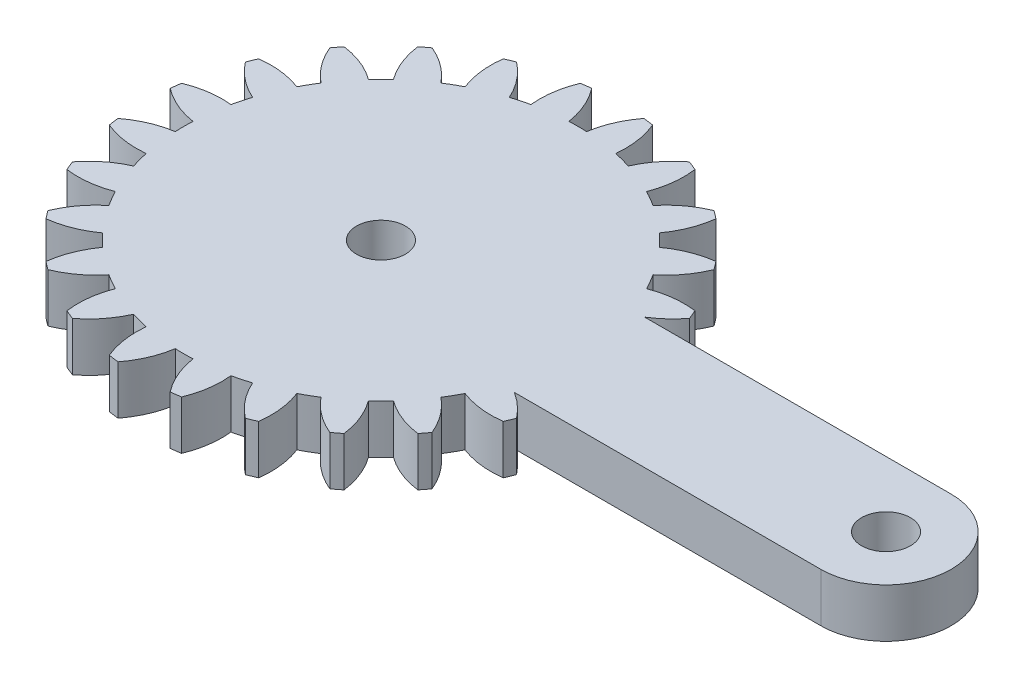
from build123d import *

# Parameters (mm, degrees)
SKETCH1_R           = 1.5
BOSS_EXTRUDE1_DEPTH = 3


with BuildPart() as part:
    # Sketch1 → Boss-Extrude1 (new body)
    with BuildSketch(Plane(origin=(0, 0, 0), x_dir=(1, 0, 0), z_dir=(0, 1, 0))):
        with BuildLine():
            Line((20.893657446, 4), (2.081641936, 4))
            ThreePointArc((2.081641936, 4), (2.861028333, 4.588201733), (3.521749436, 5.30713988))
            ThreePointArc((3.521749436, 5.30713988), (3.405395609, 5.596745198), (3.282888305, 5.883801663))
            ThreePointArc((3.282888305, 5.883801663), (1.93527598, 5.894040025), (0.627094961, 5.57027124))
            ThreePointArc((0.627094961, 5.57027124), (0.366286148, 6.046375), (0.084372603, 6.510293938))
            ThreePointArc((0.084372603, 6.510293938), (1.018855105, 7.48132754), (1.683794586, 8.65351323))
            ThreePointArc((1.683794586, 8.65351323), (1.496450048, 8.903135899), (1.303821399, 9.148703928))
            ThreePointArc((1.303821399, 9.148703928), (-0.000522033, 8.809805691), (-1.180330337, 8.158486898))
            ThreePointArc((-1.180330337, 8.158486898), (-1.555477026, 8.550865528), (-1.947855656, 8.926012217))
            ThreePointArc((-1.947855656, 8.926012217), (-1.296536862, 10.105820521), (-0.957638625, 11.410163953))
            ThreePointArc((-0.957638625, 11.410163953), (-1.203206655, 11.602792602), (-1.452829324, 11.79013714))
            ThreePointArc((-1.452829324, 11.79013714), (-2.625015014, 11.125197659), (-3.596048616, 10.190715157))
            ThreePointArc((-3.596048616, 10.190715157), (-4.059967554, 10.472628702), (-4.536071314, 10.733437515))
            ThreePointArc((-4.536071314, 10.733437515), (-4.212302529, 12.041618533), (-4.222540891, 13.389230859))
            ThreePointArc((-4.222540891, 13.389230859), (-4.509597355, 13.511738163), (-4.799202674, 13.62809199))
            ThreePointArc((-4.799202674, 13.62809199), (-5.759348103, 12.682425791), (-6.455432668, 11.528463019))
            ThreePointArc((-6.455432668, 11.528463019), (-6.976508546, 11.680699536), (-7.503891752, 11.809396783))
            ThreePointArc((-7.503891752, 11.809396783), (-7.529737283, 13.156800143), (-7.888414517, 14.455843809))
            ThreePointArc((-7.888414517, 14.455843809), (-8.197396993, 14.499881098), (-8.507248835, 14.537314892))
            ThreePointArc((-8.507248835, 14.537314892), (-9.18992168, 13.375367565), (-9.563620196, 12.080565177))
            ThreePointArc((-9.563620196, 12.080565177), (-10.106342554, 12.09275), (-10.649064912, 12.080565177))
            ThreePointArc((-10.649064912, 12.080565177), (-11.022763428, 13.375367565), (-11.705436272, 14.537314892))
            ThreePointArc((-11.705436272, 14.537314892), (-12.015288115, 14.499881098), (-12.324270591, 14.455843809))
            ThreePointArc((-12.324270591, 14.455843809), (-12.682947825, 13.156800143), (-12.708793355, 11.809396783))
            ThreePointArc((-12.708793355, 11.809396783), (-13.236176561, 11.680699536), (-13.757252439, 11.528463019))
            ThreePointArc((-13.757252439, 11.528463019), (-14.453337005, 12.682425791), (-15.413482434, 13.62809199))
            ThreePointArc((-15.413482434, 13.62809199), (-15.703087752, 13.511738163), (-15.990144217, 13.389230859))
            ThreePointArc((-15.990144217, 13.389230859), (-16.000382579, 12.041618533), (-15.676613793, 10.733437515))
            ThreePointArc((-15.676613793, 10.733437515), (-16.152717554, 10.472628702), (-16.616636492, 10.190715157))
            ThreePointArc((-16.616636492, 10.190715157), (-17.587670094, 11.125197659), (-18.759855783, 11.79013714))
            ThreePointArc((-18.759855783, 11.79013714), (-19.009478453, 11.602792602), (-19.255046482, 11.410163953))
            ThreePointArc((-19.255046482, 11.410163953), (-18.916148245, 10.105820521), (-18.264829452, 8.926012217))
            ThreePointArc((-18.264829452, 8.926012217), (-18.657208082, 8.550865528), (-19.032354771, 8.158486898))
            ThreePointArc((-19.032354771, 8.158486898), (-20.212163074, 8.809805691), (-21.516506507, 9.148703928))
            ThreePointArc((-21.516506507, 9.148703928), (-21.709135156, 8.903135899), (-21.896479694, 8.65351323))
            ThreePointArc((-21.896479694, 8.65351323), (-21.231540213, 7.48132754), (-20.297057711, 6.510293938))
            ThreePointArc((-20.297057711, 6.510293938), (-20.578971255, 6.046375), (-20.839780068, 5.57027124))
            ThreePointArc((-20.839780068, 5.57027124), (-22.147961087, 5.894040025), (-23.495573413, 5.883801663))
            ThreePointArc((-23.495573413, 5.883801663), (-23.618080717, 5.596745198), (-23.734434544, 5.30713988))
            ThreePointArc((-23.734434544, 5.30713988), (-22.788768345, 4.346994451), (-21.634805572, 3.650909885))
            ThreePointArc((-21.634805572, 3.650909885), (-21.78704209, 3.129834008), (-21.915739337, 2.602450802))
            ThreePointArc((-21.915739337, 2.602450802), (-23.263142697, 2.576605271), (-24.562186363, 2.217928037))
            ThreePointArc((-24.562186363, 2.217928037), (-24.606223651, 1.908945561), (-24.643657446, 1.599093719))
            ThreePointArc((-24.643657446, 1.599093719), (-23.481710119, 0.916420874), (-22.186907731, 0.542722358))
            ThreePointArc((-22.186907731, 0.542722358), (-22.199092554, 0), (-22.186907731, -0.542722358))
            ThreePointArc((-22.186907731, -0.542722358), (-23.481710119, -0.916420874), (-24.643657446, -1.599093719))
            ThreePointArc((-24.643657446, -1.599093719), (-24.606223651, -1.908945561), (-24.562186363, -2.217928037))
            ThreePointArc((-24.562186363, -2.217928037), (-23.263142697, -2.576605271), (-21.915739337, -2.602450802))
            ThreePointArc((-21.915739337, -2.602450802), (-21.78704209, -3.129834008), (-21.634805572, -3.650909885))
            ThreePointArc((-21.634805572, -3.650909885), (-22.788768345, -4.346994451), (-23.734434544, -5.30713988))
            ThreePointArc((-23.734434544, -5.30713988), (-23.618080717, -5.596745198), (-23.495573413, -5.883801663))
            ThreePointArc((-23.495573413, -5.883801663), (-22.147961087, -5.894040025), (-20.839780068, -5.57027124))
            ThreePointArc((-20.839780068, -5.57027124), (-20.578971255, -6.046375), (-20.297057711, -6.510293938))
            ThreePointArc((-20.297057711, -6.510293938), (-21.231540213, -7.48132754), (-21.896479694, -8.65351323))
            ThreePointArc((-21.896479694, -8.65351323), (-21.709135156, -8.903135899), (-21.516506507, -9.148703928))
            ThreePointArc((-21.516506507, -9.148703928), (-20.212163074, -8.809805691), (-19.032354771, -8.158486898))
            ThreePointArc((-19.032354771, -8.158486898), (-18.657208082, -8.550865528), (-18.264829452, -8.926012217))
            ThreePointArc((-18.264829452, -8.926012217), (-18.916148245, -10.105820521), (-19.255046482, -11.410163953))
            ThreePointArc((-19.255046482, -11.410163953), (-19.009478453, -11.602792602), (-18.759855783, -11.79013714))
            ThreePointArc((-18.759855783, -11.79013714), (-17.587670094, -11.125197659), (-16.616636492, -10.190715157))
            ThreePointArc((-16.616636492, -10.190715157), (-16.152717554, -10.472628702), (-15.676613793, -10.733437515))
            ThreePointArc((-15.676613793, -10.733437515), (-16.000382579, -12.041618533), (-15.990144217, -13.389230859))
            ThreePointArc((-15.990144217, -13.389230859), (-15.703087752, -13.511738163), (-15.413482434, -13.62809199))
            ThreePointArc((-15.413482434, -13.62809199), (-14.453337005, -12.682425791), (-13.757252439, -11.528463019))
            ThreePointArc((-13.757252439, -11.528463019), (-13.236176561, -11.680699536), (-12.708793355, -11.809396783))
            ThreePointArc((-12.708793355, -11.809396783), (-12.682947825, -13.156800143), (-12.324270591, -14.455843809))
            ThreePointArc((-12.324270591, -14.455843809), (-12.015288115, -14.499881098), (-11.705436272, -14.537314892))
            ThreePointArc((-11.705436272, -14.537314892), (-11.022763428, -13.375367565), (-10.649064912, -12.080565177))
            ThreePointArc((-10.649064912, -12.080565177), (-10.106342554, -12.09275), (-9.563620196, -12.080565177))
            ThreePointArc((-9.563620196, -12.080565177), (-9.18992168, -13.375367565), (-8.507248835, -14.537314892))
            ThreePointArc((-8.507248835, -14.537314892), (-8.197396993, -14.499881098), (-7.888414517, -14.455843809))
            ThreePointArc((-7.888414517, -14.455843809), (-7.529737283, -13.156800143), (-7.503891752, -11.809396783))
            ThreePointArc((-7.503891752, -11.809396783), (-6.976508546, -11.680699536), (-6.455432668, -11.528463019))
            ThreePointArc((-6.455432668, -11.528463019), (-5.759348103, -12.682425791), (-4.799202674, -13.62809199))
            ThreePointArc((-4.799202674, -13.62809199), (-4.509597355, -13.511738163), (-4.222540891, -13.389230859))
            ThreePointArc((-4.222540891, -13.389230859), (-4.212302529, -12.041618533), (-4.536071314, -10.733437515))
            ThreePointArc((-4.536071314, -10.733437515), (-4.059967554, -10.472628702), (-3.596048616, -10.190715157))
            ThreePointArc((-3.596048616, -10.190715157), (-2.625015014, -11.125197659), (-1.452829324, -11.79013714))
            ThreePointArc((-1.452829324, -11.79013714), (-1.203206655, -11.602792602), (-0.957638625, -11.410163953))
            ThreePointArc((-0.957638625, -11.410163953), (-1.296536862, -10.105820521), (-1.947855656, -8.926012217))
            ThreePointArc((-1.947855656, -8.926012217), (-1.555477026, -8.550865528), (-1.180330337, -8.158486898))
            ThreePointArc((-1.180330337, -8.158486898), (-0.000522033, -8.809805691), (1.303821399, -9.148703928))
            ThreePointArc((1.303821399, -9.148703928), (1.496450048, -8.903135899), (1.683794586, -8.65351323))
            ThreePointArc((1.683794586, -8.65351323), (1.018855105, -7.48132754), (0.084372603, -6.510293938))
            ThreePointArc((0.084372603, -6.510293938), (0.366286148, -6.046375), (0.627094961, -5.57027124))
            ThreePointArc((0.627094961, -5.57027124), (1.93527598, -5.894040025), (3.282888305, -5.883801663))
            ThreePointArc((3.282888305, -5.883801663), (3.405395609, -5.596745198), (3.521749436, -5.30713988))
            ThreePointArc((3.521749436, -5.30713988), (2.861028333, -4.588201733), (2.081641936, -4))
            Line((2.081641936, -4), (20.893657446, -4))
            ThreePointArc((20.893657446, -4), (24.893657446, 0), (20.893657446, 4))
        make_face()
        with Locations((-10.106342554, 0)):
            Circle(SKETCH1_R, mode=Mode.SUBTRACT)
        with Locations((20.893657446, 0)):
            Circle(SKETCH1_R, mode=Mode.SUBTRACT)
    extrude(amount=BOSS_EXTRUDE1_DEPTH)


solid = part.part
